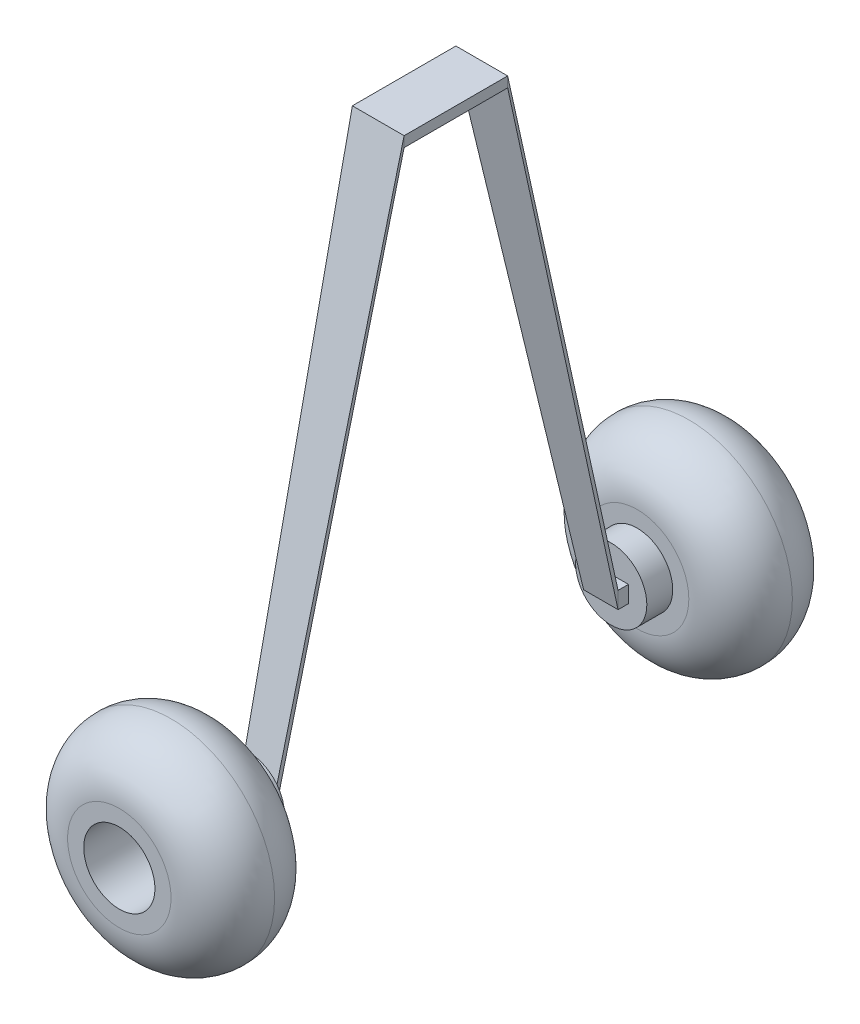
from build123d import *

# Parameters (mm, degrees)
SKETCH4_R            = 19.98814713
SKETCH4_R_2          = 6.875636986
BOSS_EXTRUDE4_DEPTH  = 20
SKETCH2_R            = 19.98814713
SKETCH2_R_2          = 6.875636986
BOSS_EXTRUDE6_DEPTH  = 20
FILLET2_R            = 10
FILLET3_R            = 10
SKETCH5_R            = 6.875636986
BOSS_EXTRUDE7_DEPTH  = 5
SKETCH6_R            = 6.875636986
BOSS_EXTRUDE8_DEPTH  = 5
SKETCH7_W            = 6.646745046
SKETCH7_H            = 3.23105662
BOSS_EXTRUDE9_DEPTH  = 2
SKETCH8_W            = 6.646745046
SKETCH8_H            = 3.23105662
BOSS_EXTRUDE10_DEPTH = 2
SKETCH9_W            = 10
SKETCH9_H            = 20
BOSS_EXTRUDE11_DEPTH = 2
SCALE3_SCALE         = 2


with BuildPart() as part:
    # Sketch4 → Boss-Extrude4 (new body)
    with BuildSketch(Plane.XY.offset(-100)):
        Circle(SKETCH4_R)
        Circle(SKETCH4_R_2, mode=Mode.SUBTRACT)
    extrude(amount=BOSS_EXTRUDE4_DEPTH)

    # Fillet3
    fillet3_edges = [part.edges().sort_by_distance(p)[0] for p in [
        (-19.98814713, 0, -100),
        (-19.98814713, 0, -80),
    ]]
    fillet(fillet3_edges, radius=FILLET3_R - 0.0001)  # a hair under: the kernel refuses the full size


with BuildPart() as body_2:
    # Sketch2 → Boss-Extrude6 (new body)
    with BuildSketch(Plane.XY):
        Circle(SKETCH2_R)
        Circle(SKETCH2_R_2, mode=Mode.SUBTRACT)
    extrude(amount=BOSS_EXTRUDE6_DEPTH)

    # Fillet2
    fillet2_edges = [body_2.edges().sort_by_distance(p)[0] for p in [
        (-19.98814713, 0, 0),
        (-19.98814713, 0, 20),
    ]]
    fillet(fillet2_edges, radius=FILLET2_R - 0.0001)  # a hair under: the kernel refuses the full size


with BuildPart() as body_3:
    # Sketch5 → Boss-Extrude7 (new body)
    with BuildSketch(Plane.XY.offset(-80)):
        Circle(SKETCH5_R)
    extrude(amount=BOSS_EXTRUDE7_DEPTH)

    # Sketch8 → Boss-Extrude10 (add)
    with BuildSketch(Plane.XY.offset(-75)):
        Rectangle(SKETCH8_W, SKETCH8_H)
    extrude(amount=BOSS_EXTRUDE10_DEPTH)



with BuildPart() as body_4:
    # Sketch6 → Boss-Extrude8 (new body)
    with BuildSketch(Plane(origin=(0, 0, 0), x_dir=(-1, 0, 0), z_dir=(0, 0, -1))):
        with Locations(Location((0, 0, 0), (0, 0, 180))):
            Circle(SKETCH6_R)
    extrude(amount=BOSS_EXTRUDE8_DEPTH)

    # Sketch7 → Boss-Extrude9 (add)
    with BuildSketch(Plane(origin=(0, 0, -5), x_dir=(-1, 0, 0), z_dir=(0, 0, -1))):
        Rectangle(SKETCH7_W, SKETCH7_H)
    extrude(amount=BOSS_EXTRUDE9_DEPTH)



with BuildPart() as body_5:
    # Sketch9 → Boss-Extrude11 (new body)
    with BuildSketch(Plane(origin=(0, 100, 0), x_dir=(1, 0, 0), z_dir=(0, 1, 0))):
        with Locations((0, 40)):
            Rectangle(SKETCH9_W, SKETCH9_H)
    extrude(amount=-BOSS_EXTRUDE11_DEPTH)


with BuildPart() as body_3_1:
    add(body_3.part)

    add(body_5.part)  # loft1 joins it to this body
    # loft from a face of the part (loft1)
    loft([body_3_1.faces().sort_by_distance((0, 0, -73))[0], body_3_1.faces().sort_by_distance((0, 99, -50))[0]])


with BuildPart() as body_4_1:
    add(body_4.part)

    add(body_3_1.part)  # loft3 joins it to this body
    # loft from a face of the part (loft3)
    loft([body_4_1.faces().sort_by_distance((0, 0, -7))[0], body_4_1.faces().sort_by_distance((0, 99, -30))[0]])


with BuildPart() as body_2_1:
    # Scale3: scaled about (0, 0, 0)
    add(body_2.part.scale(SCALE3_SCALE))


with BuildPart() as body_4_2:
    # Scale3: scaled about (0, 0, 0)
    add(body_4_1.part.scale(SCALE3_SCALE))


with BuildPart() as part_1:
    # Scale3: scaled about (0, 0, 0)
    add(part.part.scale(SCALE3_SCALE))


solid = Compound([body_2_1.part, body_4_2.part, part_1.part])
